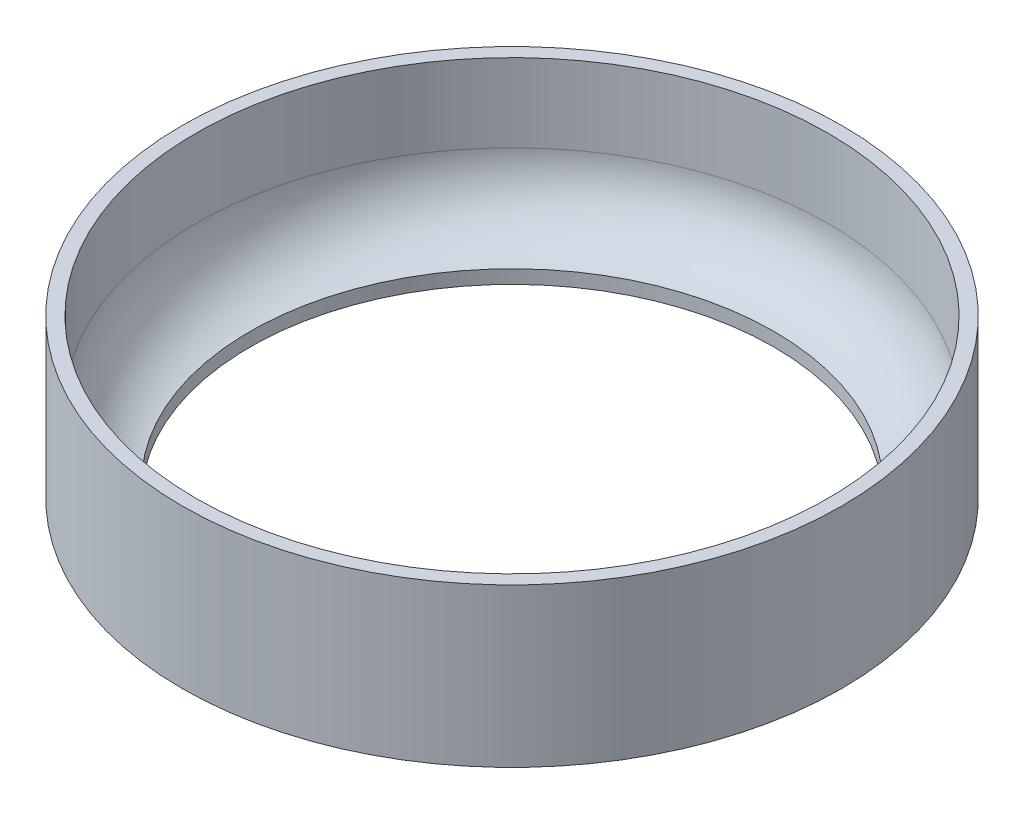
from build123d import *

# Parameters (mm, degrees)
FILLET1_R = 15


with BuildPart() as part:
    # Sketch1 → Revolve1 (revolve)
    with BuildSketch(Plane.XY, mode=Mode.PRIVATE) as revolve1_sk:
        Polygon((73, 35), (73, 0), (58, 0), (58, 3), (70, 3), (70, 35), align=None)
    revolve(revolve1_sk.sketch.rotate(Axis((0, 0, 0), (0, 1, 0)), 90), axis=Axis((0, 0, 0), (0, 1, 0)))

    # Fillet1
    # the kernel refuses this fillet: 15 mm, written as the material it adds along each edge
    with BuildSketch(Plane(origin=(0, 3, 0), x_dir=(0, 0, -1), z_dir=(1, 0, 0))) as fillet1_piece_1:
        with BuildLine():
            CenterArc((55, 14.696938457), FILLET1_R, 281.536959033, 78.463040967)
            Line((70, 14.696938457), (70.3, 14.696938457))
            Line((70.3, 14.696938457), (70.3, 0))
            Line((70.3, 0), (70, -0.3))
            ThreePointArc((70, -0.3), (64, -0.3), (58.06, -0.293938769))
            Line((58.06, -0.293938769), (58, 0))
        make_face()
    revolve(axis=Axis((0, 3, 0), (0, 1, 0)))


solid = part.part
